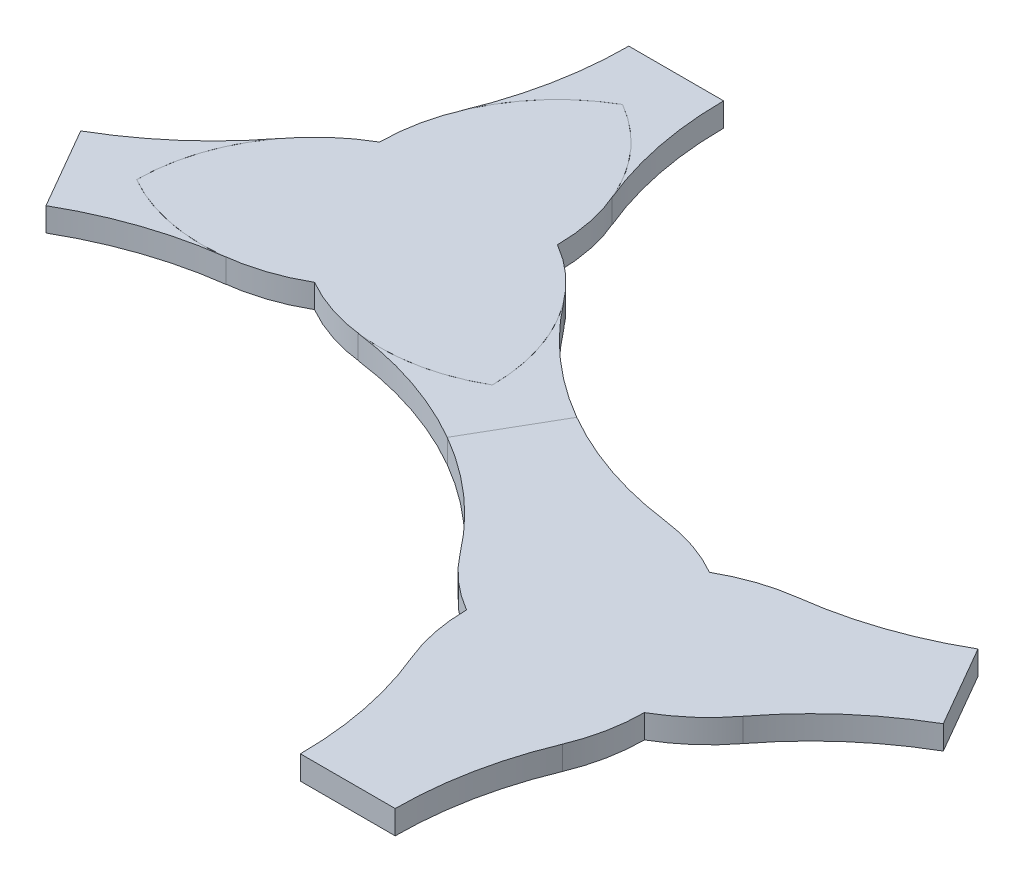
from build123d import *

# Parameters (mm, degrees)
BOSS_EXTRUDE1_DEPTH = 3
SPLIT1_DEPTH        = 3
SPLIT1_2_DEPTH      = 3
SPLIT1_3_DEPTH      = 3
SPLIT1_4_DEPTH      = 3
SPLIT1_5_DEPTH      = 3


# Read off the part's stored shape, not the designer's step: Split1
with BuildPart() as part:
    # Sketch3 → Boss-Extrude1 (new body)
    with BuildSketch(Plane(origin=(0, 0, 0), x_dir=(1, 0, 0), z_dir=(0, 1, 0))):
        with BuildLine():
            ThreePointArc((-11.258330249, 69.594010768), (-14.863463971, 67.007834664), (-17.891493772, 63.764945286))
            ThreePointArc((-17.891493772, 63.764945286), (-24.058982438, 57.159830807), (-31.401915905, 51.892309397))
            Line((-31.401915905, 51.892309397), (-25.401915905, 41.500004551))
            ThreePointArc((-25.401915905, 41.500004551), (-17.168641815, 45.225410767), (-8.364700549, 47.26405539))
            ThreePointArc((-8.364700549, 47.26405539), (-4.042261066, 48.264961433), (0, 50.094010768))
            ThreePointArc((0, 50.094010768), (4.042261066, 48.264961433), (8.364700549, 47.26405539))
            ThreePointArc((8.364700549, 47.26405539), (17.168641815, 45.225410767), (25.401915905, 41.500004551))
            Line((25.401915905, 41.500004551), (31.401915905, 51.892309397))
            ThreePointArc((31.401915905, 51.892309397), (24.058982438, 57.159830807), (17.891493772, 63.764945286))
            ThreePointArc((17.891493772, 63.764945286), (14.863463971, 67.007834664), (11.258330249, 69.594010768))
            ThreePointArc((11.258330249, 69.594010768), (8.241669751, 80.852341017), (0, 89.094010768))
            ThreePointArc((0, 89.094010768), (-8.241669751, 80.852341017), (-11.258330249, 69.594010768))
        make_face()
        with BuildLine():
            ThreePointArc((-6, 95.889718354), (-6.890340623, 86.896790728), (-9.526793223, 78.253031627))
            ThreePointArc((-9.526793223, 78.253031627), (-5.655493647, 84.457474738), (0, 89.094010768))
            ThreePointArc((0, 89.094010768), (5.655493647, 84.457474738), (9.526793223, 78.253031627))
            ThreePointArc((9.526793223, 78.253031627), (6.890340623, 86.896790728), (6, 95.889718354))
            Line((6, 95.889718354), (-6, 95.889718354))
        make_face()
    extrude(amount=BOSS_EXTRUDE1_DEPTH)

    # Mirror1: part across plane


with BuildPart() as part_1:
    add(part.part)
    add(part.part.mirror(Plane(origin=(1.08140783, 3, 0.624351102), x_dir=(-0.4999999999999996, 0, 0.8660254037844389), z_dir=(-0.8660254037844389, 0, -0.4999999999999996))))

    # Split1 outline → Split1 (cut)
    with BuildSketch(Plane(origin=(0, 0, 0), x_dir=(1, 0, 0), z_dir=(0, 1, 0))):
        with BuildLine():
            ThreePointArc((17.891493772, 63.764945286), (21.329049335, 57.310079951), (22.516660498, 50.094010768))
            ThreePointArc((22.516660498, 50.094010768), (15.673555688, 47.514477613), (8.364700549, 47.26405539))
            ThreePointArc((8.364700549, 47.26405539), (25.401915905, 41.500004551), (38.912338039, 29.627368662))
            ThreePointArc((38.912338039, 29.627368662), (41.94036784, 26.384479285), (45.545501561, 23.798303181))
            ThreePointArc((45.545501561, 23.798303181), (45.982628905, 19.383077742), (47.277038587, 15.139282322))
            ThreePointArc((47.277038587, 15.139282322), (49.913491188, 6.495523221), (50.803831811, -2.497404406))
            Line((50.803831811, -2.497404406), (62.803831811, -2.497404406))
            ThreePointArc((62.803831811, -2.497404406), (63.694172433, 6.495523221), (66.330625034, 15.139282322))
            ThreePointArc((66.330625034, 15.139282322), (67.625034716, 19.383077742), (68.06216206, 23.798303181))
            ThreePointArc((68.06216206, 23.798303181), (71.667295782, 26.384479285), (74.695325583, 29.627368662))
            ThreePointArc((74.695325583, 29.627368662), (80.862814248, 36.232483141), (88.205747716, 41.500004551))
            Line((88.205747716, 41.500004551), (82.205747716, 51.892309397))
            ThreePointArc((82.205747716, 51.892309397), (73.972473626, 48.166903181), (65.168532359, 46.128258558))
            ThreePointArc((65.168532359, 46.128258558), (60.846092876, 45.127352516), (56.803831811, 43.298303181))
            ThreePointArc((56.803831811, 43.298303181), (52.761570745, 45.127352516), (48.439131262, 46.128258558))
            ThreePointArc((48.439131262, 46.128258558), (31.401915905, 51.892309397), (17.891493772, 63.764945286))
        make_face()
        with BuildLine():
            ThreePointArc((0, 89.094010768), (5.655493647, 84.457474739), (9.526793223, 78.253031627))
            ThreePointArc((9.526793223, 78.253031627), (6.890340623, 86.896790728), (6, 95.889718354))
            Line((6, 95.889718354), (-6, 95.889718354))
            ThreePointArc((-6, 95.889718354), (-6.890340623, 86.896790728), (-9.526793223, 78.253031627))
            ThreePointArc((-9.526793223, 78.253031627), (-5.655493647, 84.457474739), (0, 89.094010768))
        make_face()
        with BuildLine():
            ThreePointArc((-25.401915905, 41.500004551), (-17.168641815, 45.225410767), (-8.364700549, 47.26405539))
            ThreePointArc((-8.364700549, 47.26405539), (-15.673555688, 47.514477613), (-22.516660498, 50.094010768))
            ThreePointArc((-22.516660498, 50.094010768), (-21.329049335, 57.310079951), (-17.891493772, 63.764945286))
            ThreePointArc((-17.891493772, 63.764945286), (-24.058982438, 57.159830807), (-31.401915905, 51.892309397))
            Line((-31.401915905, 51.892309397), (-25.401915905, 41.500004551))
        make_face()
    extrude(amount=SPLIT1_DEPTH, mode=Mode.SUBTRACT)


with BuildPart() as body_2:
    # Split1 2 outline → Split1 2 (new body)
    with BuildSketch(Plane(origin=(0, 0, 0), x_dir=(1, 0, 0), z_dir=(0, 1, 0))):
        with BuildLine():
            Line((31.401915905, 51.892309397), (25.401915905, 41.500004551))
            ThreePointArc((25.401915905, 41.500004551), (32.744849373, 36.232483141), (38.912338039, 29.627368662))
            ThreePointArc((38.912338039, 29.627368662), (41.94036784, 26.384479285), (45.545501561, 23.798303181))
            ThreePointArc((45.545501561, 23.798303181), (45.982628905, 19.383077742), (47.277038587, 15.139282322))
            ThreePointArc((47.277038587, 15.139282322), (49.913491188, 6.495523221), (50.803831811, -2.497404406))
            Line((50.803831811, -2.497404406), (62.803831811, -2.497404406))
            ThreePointArc((62.803831811, -2.497404406), (63.694172433, 6.495523221), (66.330625034, 15.139282322))
            ThreePointArc((66.330625034, 15.139282322), (67.625034716, 19.383077742), (68.06216206, 23.798303181))
            ThreePointArc((68.06216206, 23.798303181), (71.667295782, 26.384479285), (74.695325583, 29.627368662))
            ThreePointArc((74.695325583, 29.627368662), (80.862814248, 36.232483141), (88.205747716, 41.500004551))
            Line((88.205747716, 41.500004551), (82.205747716, 51.892309397))
            ThreePointArc((82.205747716, 51.892309397), (73.972473626, 48.166903181), (65.168532359, 46.128258558))
            ThreePointArc((65.168532359, 46.128258558), (60.846092876, 45.127352516), (56.803831811, 43.298303181))
            ThreePointArc((56.803831811, 43.298303181), (52.761570745, 45.127352516), (48.439131262, 46.128258558))
            ThreePointArc((48.439131262, 46.128258558), (39.635189996, 48.166903181), (31.401915905, 51.892309397))
        make_face()
    extrude(amount=SPLIT1_2_DEPTH)


with BuildPart() as body_3:
    # Split1 3 outline → Split1 3 (new body)
    with BuildSketch(Plane(origin=(0, 0, 0), x_dir=(1, 0, 0), z_dir=(0, 1, 0))):
        with BuildLine():
            ThreePointArc((17.891493772, 63.764945286), (21.329049335, 57.310079951), (22.516660498, 50.094010768))
            ThreePointArc((22.516660498, 50.094010768), (15.673555688, 47.514477613), (8.364700549, 47.26405539))
            ThreePointArc((8.364700549, 47.26405539), (17.168641815, 45.225410767), (25.401915905, 41.500004551))
            Line((25.401915905, 41.500004551), (31.401915905, 51.892309397))
            ThreePointArc((31.401915905, 51.892309397), (24.058982438, 57.159830807), (17.891493772, 63.764945286))
        make_face()
    extrude(amount=SPLIT1_3_DEPTH)


with BuildPart() as body_4:
    # Split1 4 outline → Split1 4 (new body)
    with BuildSketch(Plane(origin=(0, 0, 0), x_dir=(1, 0, 0), z_dir=(0, 1, 0))):
        with BuildLine():
            ThreePointArc((-9.526793223, 78.253031627), (-5.655493646, 84.457474739), (0, 89.094010768))
            ThreePointArc((0, 89.094010768), (5.655493646, 84.457474739), (9.526793223, 78.253031627))
            ThreePointArc((9.526793223, 78.253031627), (6.890340623, 86.896790728), (6, 95.889718354))
            Line((6, 95.889718354), (-6, 95.889718354))
            ThreePointArc((-6, 95.889718354), (-6.890340623, 86.896790728), (-9.526793223, 78.253031627))
        make_face()
    extrude(amount=SPLIT1_4_DEPTH)


with BuildPart() as body_5:
    # Split1 5 outline → Split1 5 (new body)
    with BuildSketch(Plane(origin=(0, 0, 0), x_dir=(1, 0, 0), z_dir=(0, 1, 0))):
        with BuildLine():
            ThreePointArc((-8.364700549, 47.26405539), (-15.673555688, 47.514477613), (-22.516660498, 50.094010768))
            ThreePointArc((-22.516660498, 50.094010768), (-21.329049335, 57.310079951), (-17.891493772, 63.764945286))
            ThreePointArc((-17.891493772, 63.764945286), (-24.058982438, 57.159830807), (-31.401915905, 51.892309397))
            Line((-31.401915905, 51.892309397), (-25.401915905, 41.500004551))
            ThreePointArc((-25.401915905, 41.500004551), (-17.168641815, 45.225410767), (-8.364700549, 47.26405539))
        make_face()
    extrude(amount=SPLIT1_5_DEPTH)


solid = Compound([part_1.part, body_2.part, body_3.part, body_4.part, body_5.part])
